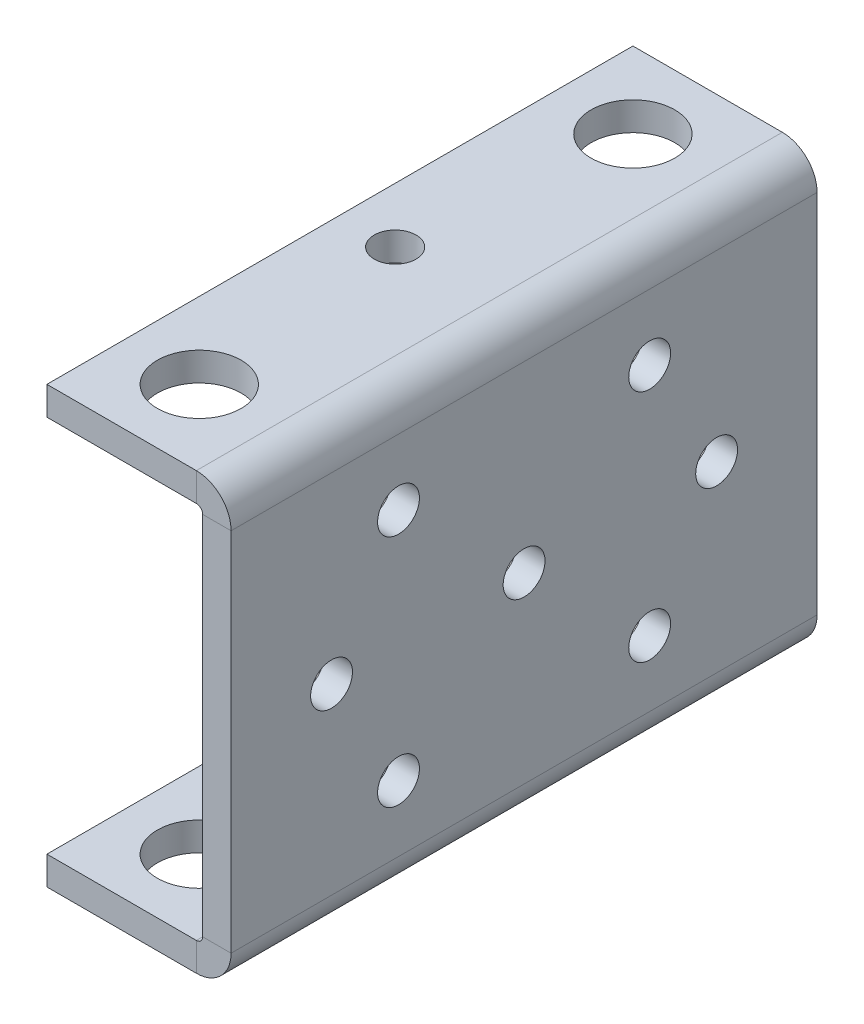
from build123d import *

# Parameters (mm, degrees)
SKETCH11_W                     = 3.4
SKETCH11_H                     = 52
BASE_FLANGE3_DEPTH             = 70
EDGE_FLANGE1_STRIP_W           = 15.1
EDGE_FLANGE1_STRIP_H           = 3.4
EDGE_FLANGE1_STRIP_CUT_DEPTH   = 70
EDGE_FLANGE1_STRIP_2_W         = 15.1
EDGE_FLANGE1_STRIP_2_H         = 3.4
EDGE_FLANGE1_STRIP_CUT_2_DEPTH = 70
EDGE_FLANGE1_DEPTH             = 70
EDGE_FLANGE1_BEND_DEPTH        = 70
CUT_EXTRUDE1_DEPTH             = 89.011135659
CUT_EXTRUDE1_DEPTH_BACK        = 89.011135659
SKETCH25_R                     = 2.5
SKETCH25_R_2                   = 5
SKETCH23_R                     = 2.5
CUT_EXTRUDE2_DEPTH             = 77.954272136


# Sheet-metal steps are written as plain solids
with BuildPart() as part:
    # Sketch11 → Base-Flange3 (new body)
    with BuildSketch(Plane.XY):
        with Locations((-1.7, 0)):
            Rectangle(SKETCH11_W, SKETCH11_H)
    extrude(amount=BASE_FLANGE3_DEPTH)

    # Edge-Flange1 strip (across the edge) → Edge-Flange1 strip cut (cut)
    with BuildSketch(Plane(origin=(-3.4, 26, 70), x_dir=(0, -1, 0), z_dir=(0, 0, -1))):
        with Locations((-3.4, -1.7)):
            Rectangle(EDGE_FLANGE1_STRIP_W, EDGE_FLANGE1_STRIP_H)
    extrude(amount=EDGE_FLANGE1_STRIP_CUT_DEPTH, mode=Mode.SUBTRACT)

    # Edge-Flange1 strip 2 (across the edge) → Edge-Flange1 strip cut 2 (cut)
    with BuildSketch(Plane(origin=(-3.4, -26, 0), x_dir=(0, 1, 0), z_dir=(0, 0, 1))):
        with Locations((-3.4, -1.7)):
            Rectangle(EDGE_FLANGE1_STRIP_2_W, EDGE_FLANGE1_STRIP_2_H)
    extrude(amount=EDGE_FLANGE1_STRIP_CUT_2_DEPTH, mode=Mode.SUBTRACT)

    # Edge-Flange1 section (across the edge) → Edge-Flange1 (add)
    with BuildSketch(Plane(origin=(-3.4, 26, 70), x_dir=(0, -1, 0), z_dir=(0, 0, -1))):
        with BuildLine():
            Line((0, 0.75), (0, 18.6))
            Line((0, 18.6), (3.4, 18.6))
            Line((3.4, 18.6), (3.4, 0.75))
            ThreePointArc((3.4, 0.75), (3.619669914, 0.219669914), (4.15, 0))
            Line((4.15, 0), (4.15, -3.4))
            ThreePointArc((4.15, -3.4), (1.215506858, -2.184493142), (0, 0.75))
        make_face()
    extrude(amount=EDGE_FLANGE1_DEPTH)

    # Edge-Flange1 section 2 (across the edge) → Edge-Flange1 bend (add)
    with BuildSketch(Plane(origin=(-3.4, -26, 0), x_dir=(0, 1, 0), z_dir=(0, 0, 1))):
        with BuildLine():
            Line((0, 0.75), (0, 18.6))
            Line((0, 18.6), (3.4, 18.6))
            Line((3.4, 18.6), (3.4, 0.75))
            ThreePointArc((3.4, 0.75), (3.619669914, 0.219669914), (4.15, 0))
            Line((4.15, 0), (4.15, -3.4))
            ThreePointArc((4.15, -3.4), (1.215506858, -2.184493142), (0, 0.75))
        make_face()
    extrude(amount=EDGE_FLANGE1_BEND_DEPTH)

    # Sketch25 → Cut-Extrude1 (cut, two sides: drawn at the far end of the back side and taken through both)
    with BuildSketch(Plane.XZ.offset(-22.6).offset(-CUT_EXTRUDE1_DEPTH_BACK)):
        with Locations((-15.4, 35)):
            Circle(SKETCH25_R)
        with Locations((-12.9, 9.1)):
            Circle(SKETCH25_R_2)
        with Locations(Location((-12.9, 60.9, 0), (0, 0, 180))):
            Circle(SKETCH25_R_2)
    extrude(amount=CUT_EXTRUDE1_DEPTH + CUT_EXTRUDE1_DEPTH_BACK, mode=Mode.SUBTRACT)

    # Sketch23 → Cut-Extrude2 (cut, through all)
    with BuildSketch(Plane.ZY.offset(3.4)):
        with Locations(Location((20, -14, 0), (0, 0, 270))):
            Circle(SKETCH23_R)
        with Locations(Location((50, -14, 0), (0, 0, 270))):
            Circle(SKETCH23_R)
        with Locations(Location((20, 14, 0), (0, 0, 90))):
            Circle(SKETCH23_R)
        with Locations(Location((50, 14, 0), (0, 0, 270))):
            Circle(SKETCH23_R)
        with Locations(Location((35, 0, 0), (0, 0, 270))):
            Circle(SKETCH23_R)
        with Locations(Location((58, 0, 0), (0, 0, 270))):
            Circle(SKETCH23_R)
        with Locations(Location((12, 0, 0), (0, 0, 90))):
            Circle(SKETCH23_R)
    extrude(amount=-CUT_EXTRUDE2_DEPTH, mode=Mode.SUBTRACT)


solid = part.part
